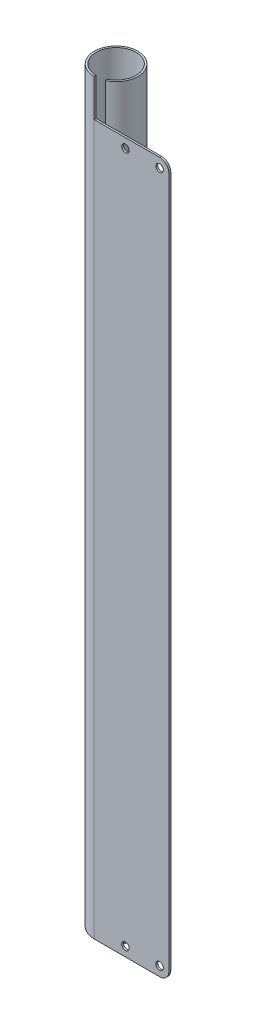
from build123d import *

# Parameters (mm, degrees)
ODGI_CIE_BAZOWE1_DEPTH     = 400
WYTNIJ_WYCI_GNI_CIE1_REACH = 404.676
OTWORY_POD_NITY_R          = 2
WYTNIJ_WYCI_GNI_CIE2_DEPTH = 403.618628481


# Sheet-metal steps are written as plain solids
with BuildPart() as part:
    # Szkic1 → Odgięcie bazowe1 (new body)
    with BuildSketch(Plane(origin=(0, 0, 0), x_dir=(1, 0, 0), z_dir=(0, 1, 0))):
        with BuildLine():
            ThreePointArc((4.952776999, 1.1), (-2.536730179, 23.121689892), (0, 0))
            Line((0, 0), (40, 0))
            Line((40, 0), (40, 1))
            Line((40, 1), (0, 1))
            ThreePointArc((0, 1), (-2.319915634, 22.145477081), (4.529462725, 2.005982906))
            Line((4.529462725, 2.005982906), (4.952776999, 1.1))
        make_face()
    extrude(amount=-ODGI_CIE_BAZOWE1_DEPTH)

    # Szkic6 → Wytnij-wyciągnięcie1 (cut, up to next)
    with BuildSketch(Plane.XY, mode=Mode.PRIVATE) as wytnij_wyci_gni_cie1_sk1:
        with BuildLine():
            Line((0, 0), (0, -20))
            Line((0, -20), (35, -20))
            ThreePointArc((35, -20), (38.535533906, -21.464466094), (40, -25))
            Line((40, -25), (40, -20))
            Line((40, -20), (40, 0))
            Line((40, 0), (0, 0))
        make_face()
    wytnij_wyci_gni_cie1_tool1 = extrude(wytnij_wyci_gni_cie1_sk1.sketch, amount=-WYTNIJ_WYCI_GNI_CIE1_REACH, mode=Mode.PRIVATE) & part.part
    add(wytnij_wyci_gni_cie1_tool1.solids().sort_by_distance((20.125793, -10.074056, 0))[0], mode=Mode.SUBTRACT)

    # otwory pod nity → Wytnij-wyciągnięcie2 (cut, through all)
    with BuildSketch(Plane(origin=(0, 0, -1), x_dir=(-1, 0, 0), z_dir=(0, 0, -1))):
        with Locations((-35, -25)):
            Circle(OTWORY_POD_NITY_R)
        with Locations(Location((-16.7, -25, 0), (0, 0, 180))):
            Circle(OTWORY_POD_NITY_R)
        with Locations((-16.7, -395)):
            Circle(OTWORY_POD_NITY_R)
        with Locations(Location((-35, -395, 0), (0, 0, 180))):
            Circle(OTWORY_POD_NITY_R)
        with BuildLine():
            Line((-35, -400), (-40, -400))
            Line((-40, -400), (-40, -395))
            ThreePointArc((-40, -395), (-38.535533906, -398.535533906), (-35, -400))
        make_face()
    extrude(amount=-WYTNIJ_WYCI_GNI_CIE2_DEPTH, mode=Mode.SUBTRACT)


solid = part.part
